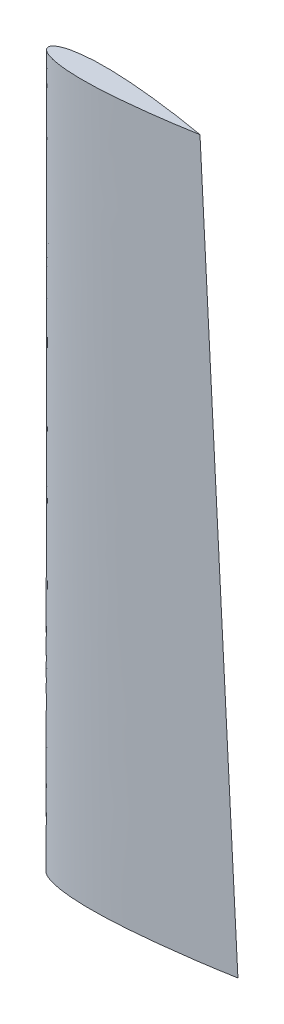
from build123d import *


with BuildPart() as part:
    # rootSketch → Loft1 section 0
    with BuildSketch(Plane(origin=(0, 0, 0), x_dir=(1, 0, 0), z_dir=(0, 1, 0))):
        with BuildLine():
            add(Edge.make_bspline(
                [(0, 0), (-0.000139838, 0.565367364), (0.053608575, 1.480154282), (0.260733418, 2.802652486), (0.7777085, 4.522019853), (1.470594607, 6.11883058), (2.485270254, 7.859667131), (3.923589883, 9.775450943), (5.991853866, 11.954221323), (9.058240175, 14.518179681), (13.704796903, 17.579181132), (20.782486791, 21.191093235), (31.757627552, 25.420383807), (48.231965173, 29.986990656), (72.755125566, 34.529739491), (104.384880296, 37.804792092), (136.281825909, 39.090472477), (166.380863049, 39.086193162), (196.466184383, 38.310602726), (221.518179643, 37.109931355), (246.543596824, 35.464669459), (271.541065161, 33.447169349), (291.522027005, 31.63481624), (311.485595353, 29.643537525), (331.432868604, 27.489295509), (348.870798819, 25.472579841), (363.808919599, 23.655074731), (376.247218729, 22.083801981), (386.198630465, 20.792119843), (398.621470561, 19.137792805), (413.539698814, 17.082748445), (430.896668055, 14.595022816), (450.768578608, 11.607719555), (468.061090398, 8.886514638), (482.985517469, 6.442038019), (495.22505107, 4.375664147), (504.116850561, 2.834955302), (511.079622405, 1.607890042), (516.63529399, 0.609482017), (518.877472606, 0.203949196), (520.000000005, -1e-09)],
                knots=[0, 0, 0, 0, 0, 0.003840944, 0.006235023, 0.009072291, 0.01219322, 0.015656839, 0.019917177, 0.025338962, 0.032592504, 0.042799388, 0.05770457, 0.079310668, 0.112503101, 0.158972616, 0.227236465, 0.295500326, 0.329632258, 0.36376419, 0.432028053, 0.466159984, 0.500291915, 0.534423847, 0.56855578, 0.602687711, 0.636819643, 0.653885609, 0.670951575, 0.688017542, 0.705083508, 0.739215439, 0.773347371, 0.807479302, 0.841611234, 0.8586772, 0.875743167, 0.892809133, 0.901342117, 0.9098751, 0.9098751, 0.9098751, 0.9098751, 0.9098751], degree=4))
            add(Edge.make_bspline(
                [(0, 0), (-0.000139838, -0.565367364), (0.053608575, -1.480154282), (0.260733418, -2.802652486), (0.7777085, -4.522019853), (1.470594607, -6.11883058), (2.485270254, -7.859667131), (3.923589883, -9.775450943), (5.991853866, -11.954221323), (9.058240175, -14.518179681), (13.704796903, -17.579181132), (20.782486791, -21.191093235), (31.757627552, -25.420383807), (48.231965173, -29.986990656), (72.755125566, -34.529739491), (104.384880296, -37.804792092), (136.281825909, -39.090472477), (166.380863049, -39.086193163), (196.466184383, -38.310602726), (221.518179642, -37.109931356), (246.543596824, -35.464669459), (271.541065161, -33.447169349), (291.522027005, -31.634816241), (311.485595352, -29.643537526), (331.432868604, -27.48929551), (348.870798819, -25.472579842), (363.808919599, -23.655074732), (376.247218729, -22.083801982), (386.198630465, -20.792119844), (398.621470561, -19.137792806), (413.539698814, -17.082748446), (430.896668055, -14.595022816), (450.768578608, -11.607719556), (468.061090398, -8.886514639), (482.985517469, -6.44203802), (495.22505107, -4.375664148), (504.116850561, -2.834955303), (511.079622405, -1.607890043), (516.63529399, -0.609482018), (518.877472606, -0.203949197), (520.000000005, -1e-09)],
                knots=[0, 0, 0, 0, 0, 0.003840944, 0.006235023, 0.009072291, 0.01219322, 0.015656839, 0.019917177, 0.025338962, 0.032592504, 0.042799388, 0.05770457, 0.079310668, 0.112503101, 0.158972616, 0.227236465, 0.295500326, 0.329632258, 0.36376419, 0.432028053, 0.466159984, 0.500291915, 0.534423847, 0.56855578, 0.602687711, 0.636819643, 0.653885609, 0.670951575, 0.688017542, 0.705083508, 0.739215439, 0.773347371, 0.807479302, 0.841611234, 0.8586772, 0.875743167, 0.892809133, 0.901342117, 0.9098751, 0.9098751, 0.9098751, 0.9098751, 0.9098751], degree=4))
        make_face()
    # tipSketch → Loft1 section 1
    with BuildSketch(Plane(origin=(0, 1950.0156, 0), x_dir=(1, 0, 0), z_dir=(0, 1, 0))):
        with BuildLine():
            add(Edge.make_bspline(
                [(0, 0), (-0.000132412, 0.452618906), (0.042917722, 1.184213362), (0.208586844, 2.241931202), (0.62216163, 3.617723242), (1.176477958, 4.89499944), (1.988211441, 6.287770656), (3.138873624, 7.820340546), (4.793481793, 9.56338984), (7.246593321, 11.614536597), (10.963836971, 14.063349182), (16.625990001, 16.952872004), (25.406101469, 20.33630865), (38.585572953, 23.989591422), (58.204099069, 27.623792605), (83.507906657, 30.243832662), (109.025457267, 31.27237895), (133.104694853, 31.268953565), (157.172939653, 30.648483717), (177.214559693, 29.687942101), (197.234851963, 28.371740247), (217.232887646, 26.757729), (233.217552674, 25.307865533), (249.188599079, 23.714807698), (265.146073827, 21.991476578), (279.096998981, 20.377998474), (291.046579019, 18.924160926), (300.998676342, 17.666877817), (308.957219414, 16.634002013), (318.900309088, 15.309665079), (330.826138751, 13.6672199), (344.726608953, 11.674333181), (360.600678071, 9.288752861), (374.470544112, 7.105274196), (386.355165303, 5.159671315), (395.248775092, 3.657138906), (400.701859779, 2.717115524), (404.625206159, 2.031511088), (407.657329623, 1.496822368), (410.41468416, 1.00781364), (413.276234016, 0.493399829), (415.101978082, 0.163159357), (416, 0)],
                knots=[0, 0, 0, 0, 0, 0.003840944, 0.006235023, 0.009072291, 0.01219322, 0.015656839, 0.019917177, 0.025338962, 0.032592504, 0.042799388, 0.05770457, 0.079310668, 0.112503101, 0.158972616, 0.227236465, 0.295500326, 0.329632258, 0.36376419, 0.432028053, 0.466159984, 0.500291915, 0.534423847, 0.56855578, 0.602687711, 0.636819643, 0.653885609, 0.670951575, 0.688017542, 0.705083508, 0.739215439, 0.773347371, 0.807479302, 0.841611234, 0.8586772, 0.875743167, 0.88427615, 0.888542642, 0.892809133, 0.901342117, 0.9098751, 0.9098751, 0.9098751, 0.9098751, 0.9098751], degree=4))
            add(Edge.make_bspline(
                [(0, 0), (-0.000132412, -0.452618906), (0.042917722, -1.184213362), (0.208586844, -2.241931202), (0.62216163, -3.617723242), (1.176477958, -4.89499944), (1.988211441, -6.287770656), (3.138873624, -7.820340546), (4.793481793, -9.56338984), (7.246593321, -11.614536597), (10.963836971, -14.063349182), (16.625990001, -16.952872004), (25.406101469, -20.33630865), (38.585572953, -23.989591422), (58.204099069, -27.623792605), (83.507906657, -30.243832662), (109.025457267, -31.27237895), (133.104694853, -31.268953565), (157.172939653, -30.648483717), (177.214559693, -29.687942101), (197.234851963, -28.371740247), (217.232887646, -26.757729), (233.217552674, -25.307865533), (249.188599079, -23.714807698), (265.146073827, -21.991476578), (279.096998981, -20.377998474), (291.046579019, -18.924160926), (300.998676342, -17.666877817), (308.957219414, -16.634002013), (318.900309088, -15.309665079), (330.826138751, -13.6672199), (344.726608953, -11.674333181), (360.600678071, -9.288752861), (374.470544112, -7.105274196), (386.355165303, -5.159671315), (395.248775092, -3.657138906), (400.701859779, -2.717115524), (404.625206159, -2.031511088), (407.657329623, -1.496822368), (410.41468416, -1.00781364), (413.276234016, -0.493399829), (415.101978082, -0.163159357), (416, 0)],
                knots=[0, 0, 0, 0, 0, 0.003840944, 0.006235023, 0.009072291, 0.01219322, 0.015656839, 0.019917177, 0.025338962, 0.032592504, 0.042799388, 0.05770457, 0.079310668, 0.112503101, 0.158972616, 0.227236465, 0.295500326, 0.329632258, 0.36376419, 0.432028053, 0.466159984, 0.500291915, 0.534423847, 0.56855578, 0.602687711, 0.636819643, 0.653885609, 0.670951575, 0.688017542, 0.705083508, 0.739215439, 0.773347371, 0.807479302, 0.841611234, 0.8586772, 0.875743167, 0.88427615, 0.888542642, 0.892809133, 0.901342117, 0.9098751, 0.9098751, 0.9098751, 0.9098751, 0.9098751], degree=4))
        make_face()
    loft()


solid = part.part
